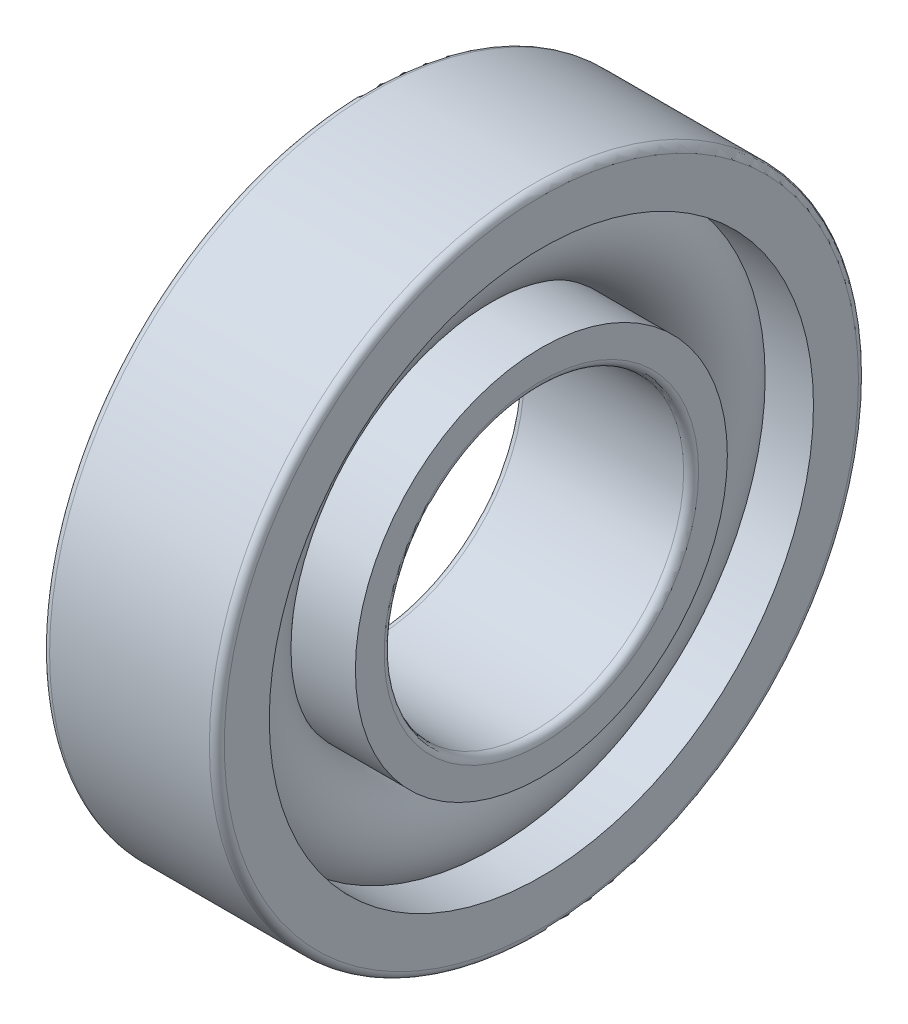
from build123d import *

# Parameters (mm, degrees)
CAGSPISKE_W     = 0.525
CAGSPISKE_H     = 0.35
CAGESPINE_ANGLE = 0.001
BALSIMSKE_R     = 1.05


with BuildPart() as part:
    # CagSpiSke → CageSpine (revolve)
    with BuildSketch(Plane.XY):
        with Locations((0, 4.75)):
            Rectangle(CAGSPISKE_W, CAGSPISKE_H)
    revolve(axis=Axis((-20.6375, 0, 0), (1, 0, 0)), revolution_arc=CAGESPINE_ANGLE)

    # BalSimSke → BallsSimplified (revolve)
    with BuildSketch(Plane.XY):
        with Locations((0, 4.75)):
            Circle(BALSIMSKE_R)
    revolve(axis=Axis((-10, 0, 0), (1, 0, 0)))

    # InnRacSke → InnerRace (revolve)
    with BuildSketch(Plane.XY):
        with BuildLine():
            Line((-0.748748957, 4.05), (-1.75, 4.05))
            Line((-1.75, 4.05), (-1.75, 3.15))
            ThreePointArc((-1.75, 3.15), (-1.706066017, 3.043933983), (-1.6, 3))
            Line((-1.6, 3), (1.6, 3))
            ThreePointArc((1.6, 3), (1.706066017, 3.043933983), (1.75, 3.15))
            Line((1.75, 3.15), (1.75, 3.725))
            Line((1.75, 3.725), (0, 3.725))
            ThreePointArc((0, 3.725), (-0.408120693, 3.809754022), (-0.748748957, 4.05))
        make_face()
    revolve(axis=Axis((-20.6375, 0, 0), (1, 0, 0)))

    # OutRacSke → OuterRace (revolve)
    with BuildSketch(Plane.XY):
        with BuildLine():
            Line((0, 5.775), (-1.75, 5.775))
            Line((-1.75, 5.775), (-1.75, 6.35))
            ThreePointArc((-1.75, 6.35), (-1.706066017, 6.456066017), (-1.6, 6.5))
            Line((-1.6, 6.5), (1.6, 6.5))
            ThreePointArc((1.6, 6.5), (1.706066017, 6.456066017), (1.75, 6.35))
            Line((1.75, 6.35), (1.75, 5.45))
            Line((1.75, 5.45), (0.748748957, 5.45))
            ThreePointArc((0.748748957, 5.45), (0.408120693, 5.690245978), (0, 5.775))
        make_face()
    revolve(axis=Axis((-20.6375, 0, 0), (1, 0, 0)))


solid = part.part
